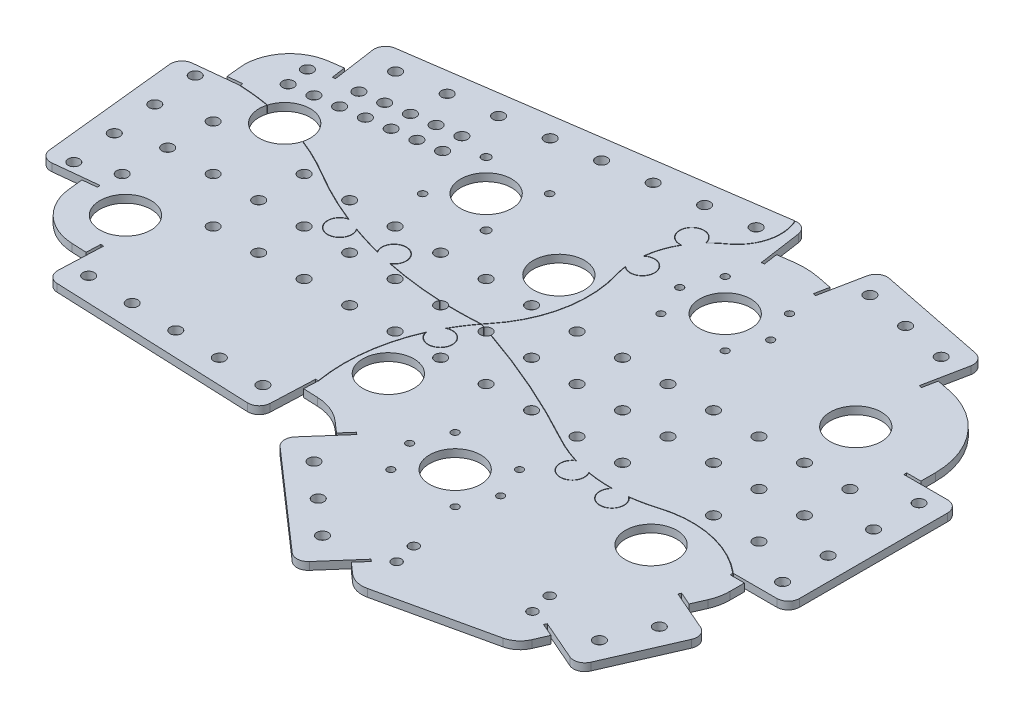
from build123d import *

# Parameters (mm, degrees)
SKETCH1_R               = 15.88080674
SKETCH1_R_2             = 2.646801123
SKETCH1_R_3             = 2.315068716
SKETCH1_R_4             = 3.529068165
SKETCH1_R_5             = 2.244487353
SKETCH1_R_6             = 2.964417258
BOSS_EXTRUDE1_DEPTH     = 4.7625
CUT_EXTRUDE_THIN3_DEPTH = 4.7625


# Read off the part's stored shape, not the designer's step: Cut-Extrude-Thin3
with BuildPart() as part:
    # Sketch1 → Boss-Extrude1 (new body)
    with BuildSketch(Plane(origin=(0, 0, 0), x_dir=(1, 0, 0), z_dir=(0, 1, 0))):
        with BuildLine():
            Line((-207.994527313, 68.690204422), (-235.016384508, 65.850092786))
            ThreePointArc((-235.016384508, 65.850092786), (-239.763810507, 63.272450781), (-241.298079484, 58.092845522))
            Line((-241.298079484, 58.092845522), (-232.55511214, -25.090932194))
            ThreePointArc((-232.55511214, -25.090932194), (-229.977470135, -29.838358193), (-224.797864877, -31.37262717))
            Line((-224.797864877, -31.37262717), (-197.776007682, -28.532515534))
            Line((-197.776007682, -28.532515534), (-197.591563646, -30.287383314))
            Line((-197.591563646, -30.287383314), (-206.365902545, -31.209603494))
            Line((-206.365902545, -31.209603494), (-205.443682365, -39.983942393))
            ThreePointArc((-205.443682365, -39.983942393), (-195.593294262, -59.82194704), (-175.172152973, -68.398284405))
            Line((-175.172152973, -68.398284405), (-166.206804345, -68.770096564))
            Line((-166.206804345, -68.770096564), (-165.84122361, -59.955003603))
            Line((-165.84122361, -59.955003603), (-164.078205018, -60.02811975))
            Line((-164.078205018, -60.02811975), (-165.204064246, -87.175485025))
            ThreePointArc((-165.204064246, -87.175485025), (-163.345363178, -92.247715527), (-158.444454465, -94.520023982))
            Line((-158.444454465, -94.520023982), (-35.19893622, -99.631278891))
            ThreePointArc((-35.19893622, -99.631278891), (-30.126705718, -97.772577824), (-27.854397263, -92.871669111))
            Line((-27.854397263, -92.871669111), (-26.728538035, -65.724303836))
            Line((-26.728538035, -65.724303836), (-24.965519442, -65.797419983))
            Line((-24.965519442, -65.797419983), (-25.331100178, -74.612512944))
            Line((-25.331100178, -74.612512944), (-16.36575155, -74.984325103))
            ThreePointArc((-16.36575155, -74.984325103), (-6.586571335, -77.078299148), (1.939798053, -82.304972855))
            Line((1.939798053, -82.304972855), (8.682308062, -88.211652405))
            Line((8.682308062, -88.211652405), (14.495969036, -81.575323656))
            Line((14.495969036, -81.575323656), (15.823234786, -82.73805585))
            Line((15.823234786, -82.73805585), (-2.080782647, -103.175598759))
            ThreePointArc((-2.080782647, -103.175598759), (-3.814497375, -108.291898708), (-1.422648427, -113.135590537))
            Line((-1.422648427, -113.135590537), (59.39156844, -166.411016249))
            ThreePointArc((59.39156844, -166.411016249), (64.507868389, -168.144730977), (69.351560218, -165.752882029))
            Line((69.351560218, -165.752882029), (87.255577651, -145.31533912))
            Line((87.255577651, -145.31533912), (88.582843401, -146.478071315))
            Line((88.582843401, -146.478071315), (82.769182427, -153.114400064))
            Line((82.769182427, -153.114400064), (89.511692436, -159.021079614))
            ThreePointArc((89.511692436, -159.021079614), (95.32752083, -162.082016245), (101.898974104, -162.17790595))
            Line((101.898974104, -162.17790595), (170.558308364, -146.799038555))
            ThreePointArc((170.558308364, -146.799038555), (176.460971128, -143.909096468), (180.415393718, -138.659740798))
            Line((180.415393718, -138.659740798), (183.994034375, -130.441247288))
            Line((183.994034375, -130.441247288), (175.90496596, -126.918963177))
            Line((175.90496596, -126.918963177), (176.609422782, -125.301149494))
            Line((176.609422782, -125.301149494), (201.52088951, -136.148537467))
            ThreePointArc((201.52088951, -136.148537467), (206.922080119, -136.245655623), (210.809971531, -132.495110024))
            Line((210.809971531, -132.495110024), (229.775779526, -88.939362223))
            ThreePointArc((229.775779526, -88.939362223), (229.872897682, -83.538171614), (226.122352083, -79.650280202))
            Line((226.122352083, -79.650280202), (201.210885355, -68.802892229))
            Line((201.210885355, -68.802892229), (201.915342177, -67.185078546))
            Line((201.915342177, -67.185078546), (210.004410593, -70.707362657))
            Line((210.004410593, -70.707362657), (213.583051249, -62.488869147))
            ThreePointArc((213.583051249, -62.488869147), (215.33746597, -56.974149481), (215.930577637, -51.217559992))
            Line((215.930577637, -51.217559992), (215.930577637, -42.253726854))
            Line((215.930577637, -42.253726854), (207.107907225, -42.253726854))
            Line((207.107907225, -42.253726854), (207.107907225, -40.489192771))
            Line((207.107907225, -40.489192771), (234.278608364, -40.489192771))
            ThreePointArc((234.278608364, -40.489192771), (239.269464425, -38.421912503), (241.336744693, -33.431056442))
            Line((241.336744693, -33.431056442), (241.336744693, 58.479727971))
            ThreePointArc((241.336744693, 58.479727971), (239.269464425, 63.470584031), (234.278608364, 65.5378643))
            Line((234.278608364, 65.5378643), (207.107907225, 65.5378643))
            Line((207.107907225, 65.5378643), (207.107907225, 67.302398382))
            Line((207.107907225, 67.302398382), (215.930577637, 67.302398382))
            Line((215.930577637, 67.302398382), (215.930577637, 76.26623152))
            ThreePointArc((215.930577637, 76.26623152), (204.734700664, 107.586523708), (176.221159535, 124.712128406))
            Line((176.221159535, 124.712128406), (167.570106519, 126.4438313))
            Line((167.570106519, 126.4438313), (165.838403626, 117.792778284))
            Line((165.838403626, 117.792778284), (164.108193023, 118.139118863))
            Line((164.108193023, 118.139118863), (169.441224813, 144.781299185))
            ThreePointArc((169.441224813, 144.781299185), (168.393756089, 150.080837013), (163.905744715, 153.087503911))
            Line((163.905744715, 153.087503911), (97.171385516, 166.4458873))
            ThreePointArc((97.171385516, 166.4458873), (91.871847687, 165.398418576), (88.865180789, 160.910407202))
            Line((88.865180789, 160.910407202), (83.532149, 134.268226881))
            Line((83.532149, 134.268226881), (81.801938397, 134.614567459))
            Line((81.801938397, 134.614567459), (83.53364129, 143.265620475))
            Line((83.53364129, 143.265620475), (74.882588275, 144.997323368))
            ThreePointArc((74.882588275, 144.997323368), (66.534394912, 145.93995154), (58.147186406, 145.454550925))
            Line((58.147186406, 145.454550925), (49.414485612, 144.197789199))
            Line((49.414485612, 144.197789199), (50.671247338, 135.465088405))
            Line((50.671247338, 135.465088405), (48.92470718, 135.21373606))
            Line((48.92470718, 135.21373606), (45.054326028, 162.107362631))
            ThreePointArc((45.054326028, 162.107362631), (42.297195161, 166.7528466), (37.062756012, 168.088113884))
            Line((37.062756012, 168.088113884), (-179.972910693, 136.853547901))
            ThreePointArc((-179.972910693, 136.853547901), (-184.618394663, 134.096417034), (-185.953661947, 128.861977885))
            Line((-185.953661947, 128.861977885), (-182.083280795, 101.968351315))
            Line((-182.083280795, 101.968351315), (-183.829820954, 101.716998969))
            Line((-183.829820954, 101.716998969), (-185.08658268, 110.449699763))
            Line((-185.08658268, 110.449699763), (-193.819283474, 109.192938037))
            ThreePointArc((-193.819283474, 109.192938037), (-212.073902944, 98.593179163), (-217.875530429, 78.297190921))
            Line((-217.875530429, 78.297190921), (-216.953310249, 69.522852022))
            Line((-216.953310249, 69.522852022), (-208.178971349, 70.445072202))
            Line((-208.178971349, 70.445072202), (-207.994527313, 68.690204422))
        make_face()
        with Locations(Location((-7.165785995, 65.679027026, 0), (0, 0, 90))):
            Circle(SKETCH1_R, mode=Mode.SUBTRACT)
        with Locations(Location((-53.796702013, 67.147119383, 0), (0, 0, 90))):
            Circle(SKETCH1_R_2, mode=Mode.SUBTRACT)
        with Locations(Location((-73.503018644, 86.853436013, 0), (0, 0, 90))):
            Circle(SKETCH1_R, mode=Mode.SUBTRACT)
        with Locations(Location((-93.209335275, 67.147119383, 0), (0, 0, 90))):
            Circle(SKETCH1_R_3, mode=Mode.SUBTRACT)
        with Locations(Location((-93.209335275, 106.559752644, 0), (0, 0, 90))):
            Circle(SKETCH1_R_2, mode=Mode.SUBTRACT)
        with Locations(Location((-53.796702013, 106.559752644, 0), (0, 0, 90))):
            Circle(SKETCH1_R_3, mode=Mode.SUBTRACT)
        with Locations(Location((28.36199031, 152.574240957, 0), (0, 0, 90))):
            Circle(SKETCH1_R_4, mode=Mode.SUBTRACT)
        with Locations(Location((0.41734777, 148.552603433, 0), (0, 0, 90))):
            Circle(SKETCH1_R_4, mode=Mode.SUBTRACT)
        with Locations(Location((-27.527294769, 144.530965909, 0), (0, 0, 90))):
            Circle(SKETCH1_R_4, mode=Mode.SUBTRACT)
        with Locations(Location((-55.471937309, 140.509328385, 0), (0, 0, 90))):
            Circle(SKETCH1_R_4, mode=Mode.SUBTRACT)
        with Locations(Location((-83.416579848, 136.487690861, 0), (0, 0, 90))):
            Circle(SKETCH1_R_4, mode=Mode.SUBTRACT)
        with Locations(Location((-111.361222388, 132.466053337, 0), (0, 0, 90))):
            Circle(SKETCH1_R_4, mode=Mode.SUBTRACT)
        with Locations(Location((-151.876467149, 90.27112741, 0), (0, 0, 90))):
            Circle(SKETCH1_R_4, mode=Mode.SUBTRACT)
        with Locations(Location((-137.904145879, 92.281946172, 0), (0, 0, 90))):
            Circle(SKETCH1_R_4, mode=Mode.SUBTRACT)
        with Locations(Location((-123.931824609, 94.292764934, 0), (0, 0, 90))):
            Circle(SKETCH1_R_4, mode=Mode.SUBTRACT)
        with Locations(Location((-109.959503339, 96.303583696, 0), (0, 0, 90))):
            Circle(SKETCH1_R_4, mode=Mode.SUBTRACT)
        with Locations(Location((-111.970322101, 110.275904966, 0), (0, 0, 90))):
            Circle(SKETCH1_R_4, mode=Mode.SUBTRACT)
        with Locations(Location((-125.942643371, 108.265086204, 0), (0, 0, 90))):
            Circle(SKETCH1_R_4, mode=Mode.SUBTRACT)
        with Locations(Location((-139.914964641, 106.254267442, 0), (0, 0, 90))):
            Circle(SKETCH1_R_4, mode=Mode.SUBTRACT)
        with Locations(Location((-139.305864927, 128.444415813, 0), (0, 0, 90))):
            Circle(SKETCH1_R_4, mode=Mode.SUBTRACT)
        with Locations(Location((-153.887285911, 104.24344868, 0), (0, 0, 90))):
            Circle(SKETCH1_R_4, mode=Mode.SUBTRACT)
        with Locations(Location((-167.250507466, 124.422778289, 0), (0, 0, 90))):
            Circle(SKETCH1_R_4, mode=Mode.SUBTRACT)
        with Locations(Location((-167.85960718, 102.232629918, 0), (0, 0, 90))):
            Circle(SKETCH1_R_4, mode=Mode.SUBTRACT)
        with Locations(Location((-165.848788418, 88.260308648, 0), (0, 0, 90))):
            Circle(SKETCH1_R_4, mode=Mode.SUBTRACT)
        with Locations(Location((-179.821109688, 86.249489886, 0), (0, 0, 90))):
            Circle(SKETCH1_R_4, mode=Mode.SUBTRACT)
        with Locations(Location((-195.80424972, 98.210992394, 0), (0, 0, 90))):
            Circle(SKETCH1_R_4, mode=Mode.SUBTRACT)
        with Locations(Location((-193.793430958, 84.238671124, 0), (0, 0, 90))):
            Circle(SKETCH1_R_4, mode=Mode.SUBTRACT)
        with Locations(Location((-197.059154913, 40.975549874, 0), (0, 0, 90))):
            Circle(SKETCH1_R_4, mode=Mode.SUBTRACT)
        with Locations(Location((-197.059154913, 12.743004558, 0), (0, 0, 90))):
            Circle(SKETCH1_R_4, mode=Mode.SUBTRACT)
        with Locations(Location((-197.059154913, -15.489540758, 0), (0, 0, 90))):
            Circle(SKETCH1_R_4, mode=Mode.SUBTRACT)
        with Locations(Location((-218.460996708, -24.140317766, 0), (0, 0, 90))):
            Circle(SKETCH1_R_4, mode=Mode.SUBTRACT)
        with Locations(Location((-221.412101285, 3.937566713, 0), (0, 0, 90))):
            Circle(SKETCH1_R_4, mode=Mode.SUBTRACT)
        with Locations(Location((-224.363205861, 32.015451192, 0), (0, 0, 90))):
            Circle(SKETCH1_R_4, mode=Mode.SUBTRACT)
        with Locations(Location((-227.314310437, 60.093335671, 0), (0, 0, 90))):
            Circle(SKETCH1_R_4, mode=Mode.SUBTRACT)
        with Locations(Location((155.451210136, 140.383561523, 0), (0, 0, 90))):
            Circle(SKETCH1_R_4, mode=Mode.SUBTRACT)
        with Locations(Location((127.767840486, 145.925010781, 0), (0, 0, 90))):
            Circle(SKETCH1_R_4, mode=Mode.SUBTRACT)
        with Locations(Location((100.084470837, 151.466460039, 0), (0, 0, 90))):
            Circle(SKETCH1_R_4, mode=Mode.SUBTRACT)
        with Locations(Location((45.22162783, 76.588002238, 0), (0, 0, 90))):
            Circle(SKETCH1_R_5, mode=Mode.SUBTRACT)
        with Locations(Location((36.952506757, 96.551426481, 0), (0, 0, 90))):
            Circle(SKETCH1_R_5, mode=Mode.SUBTRACT)
        with Locations(Location((45.22162783, 116.514850724, 0), (0, 0, 90))):
            Circle(SKETCH1_R_5, mode=Mode.SUBTRACT)
        with Locations(Location((85.148476316, 116.514850724, 0), (0, 0, 90))):
            Circle(SKETCH1_R_5, mode=Mode.SUBTRACT)
        with Locations(Location((93.417597389, 96.551426481, 0), (0, 0, 90))):
            Circle(SKETCH1_R_5, mode=Mode.SUBTRACT)
        with Locations(Location((85.148476316, 76.588002238, 0), (0, 0, 90))):
            Circle(SKETCH1_R_5, mode=Mode.SUBTRACT)
        with Locations(Location((65.185052073, 96.551426481, 0), (0, 0, 90))):
            Circle(SKETCH1_R, mode=Mode.SUBTRACT)
        with Locations(Location((166.523623333, 76.26623152, 0), (0, 0, 90))):
            Circle(SKETCH1_R, mode=Mode.SUBTRACT)
        with Locations(Location((227.220472035, 54.873153738, 0), (0, 0, 90))):
            Circle(SKETCH1_R_4, mode=Mode.SUBTRACT)
        with Locations(Location((227.220472035, 26.640608422, 0), (0, 0, 90))):
            Circle(SKETCH1_R_4, mode=Mode.SUBTRACT)
        with Locations(Location((227.220472035, -29.82448221, 0), (0, 0, 90))):
            Circle(SKETCH1_R_4, mode=Mode.SUBTRACT)
        with Locations(Location((227.220472035, -1.591936894, 0), (0, 0, 90))):
            Circle(SKETCH1_R_4, mode=Mode.SUBTRACT)
        with Locations(Location((198.196479514, -15.489540758, 0), (0, 0, 90))):
            Circle(SKETCH1_R_4, mode=Mode.SUBTRACT)
        with Locations(Location((198.196479514, 12.743004558, 0), (0, 0, 90))):
            Circle(SKETCH1_R_4, mode=Mode.SUBTRACT)
        with Locations(Location((198.196479514, 40.975549874, 0), (0, 0, 90))):
            Circle(SKETCH1_R_4, mode=Mode.SUBTRACT)
        with Locations(Location((169.963934198, 40.975549874, 0), (0, 0, 90))):
            Circle(SKETCH1_R_4, mode=Mode.SUBTRACT)
        with Locations(Location((169.963934198, 12.743004558, 0), (0, 0, 90))):
            Circle(SKETCH1_R_4, mode=Mode.SUBTRACT)
        with Locations(Location((169.963934198, -15.489540758, 0), (0, 0, 90))):
            Circle(SKETCH1_R_4, mode=Mode.SUBTRACT)
        with Locations(Location((141.731388882, 12.743004558, 0), (0, 0, 90))):
            Circle(SKETCH1_R_4, mode=Mode.SUBTRACT)
        with Locations(Location((141.731388882, 40.975549874, 0), (0, 0, 90))):
            Circle(SKETCH1_R_4, mode=Mode.SUBTRACT)
        with Locations(Location((113.498843566, 40.975549874, 0), (0, 0, 90))):
            Circle(SKETCH1_R_4, mode=Mode.SUBTRACT)
        with Locations(Location((113.498843566, 12.743004558, 0), (0, 0, 90))):
            Circle(SKETCH1_R_4, mode=Mode.SUBTRACT)
        with Locations(Location((113.498843566, -15.489540758, 0), (0, 0, 90))):
            Circle(SKETCH1_R_4, mode=Mode.SUBTRACT)
        with Locations(Location((85.266298249, -15.489540758, 0), (0, 0, 90))):
            Circle(SKETCH1_R_4, mode=Mode.SUBTRACT)
        with Locations(Location((85.266298249, 12.743004558, 0), (0, 0, 90))):
            Circle(SKETCH1_R_4, mode=Mode.SUBTRACT)
        with Locations(Location((85.266298249, 40.975549874, 0), (0, 0, 90))):
            Circle(SKETCH1_R_4, mode=Mode.SUBTRACT)
        with Locations(Location((57.033752933, 40.975549874, 0), (0, 0, 90))):
            Circle(SKETCH1_R_4, mode=Mode.SUBTRACT)
        with Locations(Location((57.033752933, 12.743004558, 0), (0, 0, 90))):
            Circle(SKETCH1_R_4, mode=Mode.SUBTRACT)
        with Locations(Location((57.033752933, -15.489540758, 0), (0, 0, 90))):
            Circle(SKETCH1_R_4, mode=Mode.SUBTRACT)
        with Locations(Location((28.801207617, -15.489540758, 0), (0, 0, 90))):
            Circle(SKETCH1_R_4, mode=Mode.SUBTRACT)
        with Locations(Location((28.801207617, 12.743004558, 0), (0, 0, 90))):
            Circle(SKETCH1_R_4, mode=Mode.SUBTRACT)
        with Locations(Location((28.801207617, 40.975549874, 0), (0, 0, 90))):
            Circle(SKETCH1_R_4, mode=Mode.SUBTRACT)
        with Locations(Location((0.568662301, 40.975549874, 0), (0, 0, 90))):
            Circle(SKETCH1_R_4, mode=Mode.SUBTRACT)
        with Locations(Location((0.568662301, 12.743004558, 0), (0, 0, 90))):
            Circle(SKETCH1_R_4, mode=Mode.SUBTRACT)
        with Locations(Location((-27.663883015, 40.975549874, 0), (0, 0, 90))):
            Circle(SKETCH1_R_4, mode=Mode.SUBTRACT)
        with Locations(Location((-27.663883015, 12.743004558, 0), (0, 0, 90))):
            Circle(SKETCH1_R_4, mode=Mode.SUBTRACT)
        with Locations(Location((-55.896428332, 12.743004558, 0), (0, 0, 90))):
            Circle(SKETCH1_R_4, mode=Mode.SUBTRACT)
        with Locations(Location((-55.896428332, 40.975549874, 0), (0, 0, 90))):
            Circle(SKETCH1_R_4, mode=Mode.SUBTRACT)
        with Locations(Location((-84.128973648, 40.975549874, 0), (0, 0, 90))):
            Circle(SKETCH1_R_4, mode=Mode.SUBTRACT)
        with Locations(Location((-112.361518964, 40.975549874, 0), (0, 0, 90))):
            Circle(SKETCH1_R_4, mode=Mode.SUBTRACT)
        with Locations(Location((-84.128973648, 12.743004558, 0), (0, 0, 90))):
            Circle(SKETCH1_R_4, mode=Mode.SUBTRACT)
        with Locations(Location((-112.361518964, 12.743004558, 0), (0, 0, 90))):
            Circle(SKETCH1_R_4, mode=Mode.SUBTRACT)
        with Locations(Location((-140.59406428, 12.743004558, 0), (0, 0, 90))):
            Circle(SKETCH1_R_4, mode=Mode.SUBTRACT)
        with Locations(Location((-140.59406428, -15.489540758, 0), (0, 0, 90))):
            Circle(SKETCH1_R_4, mode=Mode.SUBTRACT)
        with Locations(Location((-112.361518964, -15.489540758, 0), (0, 0, 90))):
            Circle(SKETCH1_R_4, mode=Mode.SUBTRACT)
        with Locations(Location((-84.128973648, -15.489540758, 0), (0, 0, 90))):
            Circle(SKETCH1_R_4, mode=Mode.SUBTRACT)
        with Locations(Location((-55.896428332, -15.489540758, 0), (0, 0, 90))):
            Circle(SKETCH1_R_4, mode=Mode.SUBTRACT)
        with Locations(Location((-27.663883015, -15.489540758, 0), (0, 0, 90))):
            Circle(SKETCH1_R_4, mode=Mode.SUBTRACT)
        with Locations(Location((0.568662301, -15.489540758, 0), (0, 0, 90))):
            Circle(SKETCH1_R_4, mode=Mode.SUBTRACT)
        with Locations(Location((-7.165785995, -40.19301791, 0), (0, 0, 90))):
            Circle(SKETCH1_R, mode=Mode.SUBTRACT)
        with Locations(Location((45.22162783, -51.101993121, 0), (0, 0, 90))):
            Circle(SKETCH1_R_5, mode=Mode.SUBTRACT)
        with Locations(Location((36.952506757, -71.065417365, 0), (0, 0, 90))):
            Circle(SKETCH1_R_5, mode=Mode.SUBTRACT)
        with Locations(Location((45.22162783, -91.028841608, 0), (0, 0, 90))):
            Circle(SKETCH1_R_5, mode=Mode.SUBTRACT)
        with Locations(Location((85.148476316, -91.028841608, 0), (0, 0, 90))):
            Circle(SKETCH1_R_5, mode=Mode.SUBTRACT)
        with Locations(Location((93.417597389, -71.065417365, 0), (0, 0, 90))):
            Circle(SKETCH1_R_5, mode=Mode.SUBTRACT)
        with Locations(Location((85.148476316, -51.101993121, 0), (0, 0, 90))):
            Circle(SKETCH1_R_5, mode=Mode.SUBTRACT)
        with Locations(Location((166.523623333, -50.780222403, 0), (0, 0, 90))):
            Circle(SKETCH1_R, mode=Mode.SUBTRACT)
        with Locations(Location((212.986020642, -92.139072081, 0), (0, 0, 90))):
            Circle(SKETCH1_R_4, mode=Mode.SUBTRACT)
        with Locations(Location((201.714711487, -118.02409101, 0), (0, 0, 90))):
            Circle(SKETCH1_R_4, mode=Mode.SUBTRACT)
        with Locations(Location((165.420801083, -123.357493008, 0), (0, 0, 90))):
            Circle(SKETCH1_R_6, mode=Mode.SUBTRACT)
        with Locations(Location((162.335376973, -109.582540674, 0), (0, 0, 90))):
            Circle(SKETCH1_R_6, mode=Mode.SUBTRACT)
        with Locations(Location((93.4606153, -125.009661225, 0), (0, 0, 90))):
            Circle(SKETCH1_R_6, mode=Mode.SUBTRACT)
        with Locations(Location((96.546039411, -138.784613559, 0), (0, 0, 90))):
            Circle(SKETCH1_R_6, mode=Mode.SUBTRACT)
        with Locations(Location((59.522569562, -147.758892512, 0), (0, 0, 90))):
            Circle(SKETCH1_R_4, mode=Mode.SUBTRACT)
        with Locations(Location((38.286317565, -129.155177395, 0), (0, 0, 90))):
            Circle(SKETCH1_R_4, mode=Mode.SUBTRACT)
        with Locations(Location((17.050065568, -110.551462278, 0), (0, 0, 90))):
            Circle(SKETCH1_R_4, mode=Mode.SUBTRACT)
        with Locations(Location((-39.921852993, -85.307002444, 0), (0, 0, 90))):
            Circle(SKETCH1_R_4, mode=Mode.SUBTRACT)
        with Locations(Location((-68.130150469, -84.137144091, 0), (0, 0, 90))):
            Circle(SKETCH1_R_4, mode=Mode.SUBTRACT)
        with Locations(Location((-96.338447944, -82.967285738, 0), (0, 0, 90))):
            Circle(SKETCH1_R_4, mode=Mode.SUBTRACT)
        with Locations(Location((-124.54674542, -81.797427385, 0), (0, 0, 90))):
            Circle(SKETCH1_R_4, mode=Mode.SUBTRACT)
        with Locations(Location((-152.755042895, -80.627569033, 0), (0, 0, 90))):
            Circle(SKETCH1_R_4, mode=Mode.SUBTRACT)
        with Locations(Location((-173.856062327, -36.663949745, 0), (0, 0, 90))):
            Circle(SKETCH1_R, mode=Mode.SUBTRACT)
        with Locations(Location((-168.826609597, 12.743004558, 0), (0, 0, 90))):
            Circle(SKETCH1_R_4, mode=Mode.SUBTRACT)
        with Locations(Location((-140.59406428, 40.975549874, 0), (0, 0, 90))):
            Circle(SKETCH1_R_4, mode=Mode.SUBTRACT)
        with Locations(Location((65.185052073, -71.065417365, 0), (0, 0, 90))):
            Circle(SKETCH1_R, mode=Mode.SUBTRACT)
        with Locations(Location((-173.856062327, 62.149958862, 0), (0, 0, 90))):
            Circle(SKETCH1_R, mode=Mode.SUBTRACT)
    extrude(amount=BOSS_EXTRUDE1_DEPTH)

    # Cut-Extrude-Thin3 outline → Cut-Extrude-Thin3 (cut)
    with BuildSketch(Plane(origin=(0, 0, 0), x_dir=(1, 0, 0), z_dir=(0, 1, 0))):
        with BuildLine():
            ThreePointArc((4.05020196, 12.165766559), (43.449358347, -3.244296378), (81.392453769, -21.954856859))
            ThreePointArc((81.392453769, -21.954856859), (89.302103367, -25.778704162), (97.556786599, -28.786123272))
            ThreePointArc((97.556786599, -28.786123272), (100.132804747, -42.476101593), (108.600535843, -31.414957619))
            ThreePointArc((108.600535843, -31.414957619), (116.109802617, -32.358476473), (123.672633185, -32.646415883))
            ThreePointArc((123.672633185, -32.646415883), (129.770480963, -45.437893738), (134.140257643, -31.957882425))
            ThreePointArc((134.140257643, -31.957882425), (141.61002378, -30.679660908), (148.940371534, -28.756835335))
            ThreePointArc((148.940371534, -28.756835335), (179.496439901, -27.240760844), (207.025910083, -40.586174567))
            Line((207.025910083, -40.586174567), (207.107907225, -40.489192771))
            Line((207.107907225, -40.489192771), (207.314348075, -40.489192771))
            Line((207.314348075, -40.489192771), (207.188000082, -40.390600988))
            ThreePointArc((207.188000082, -40.390600988), (179.545905752, -26.991620968), (148.865295493, -28.514184169))
            ThreePointArc((148.865295493, -28.514184169), (141.251986239, -30.49665529), (133.490487209, -31.781879921))
            ThreePointArc((133.490487209, -31.781879921), (129.753809522, -45.184441449), (124.29375092, -32.386817618))
            ThreePointArc((124.29375092, -32.386817618), (116.166945261, -32.108291159), (108.101834114, -31.070731811))
            ThreePointArc((108.101834114, -31.070731811), (100.191623026, -42.22900564), (98.157093863, -28.703503602))
            ThreePointArc((98.157093863, -28.703503602), (89.654162249, -25.651266182), (81.514401201, -21.732045675))
            ThreePointArc((81.514401201, -21.732045675), (43.528008662, -3.001375524), (4.083188574, 12.422962084))
            ThreePointArc((4.083188574, 12.422962084), (4.069058282, 12.294061253), (4.05020196, 12.165766559))
        make_face()
        Polygon((-24.854206624, -65.858562902), (-24.965519442, -65.797419983), (-24.977352894, -66.082754985), align=None)
        Polygon((-208.042328138, 68.572543548), (-207.994527313, 68.690204422), (-208.262595706, 68.662029299), align=None)
        Polygon((207.107907225, -40.650282562), (207.107907225, -40.489192771), (207.029778308, -40.589317056), align=None)
        with BuildLine():
            ThreePointArc((-4.866512611, 15.127763301), (-3.711951749, 14.754778673), (-2.558306483, 14.378971652))
            ThreePointArc((-2.558306483, 14.378971652), (-2.4960933, 14.49274603), (-2.429742264, 14.604158011))
            ThreePointArc((-2.429742264, 14.604158011), (-3.565623892, 14.974334873), (-4.702393148, 15.341776897))
            ThreePointArc((-4.702393148, 15.341776897), (-3.680650981, 16.648935589), (-2.638249769, 17.939679798))
            ThreePointArc((-2.638249769, 17.939679798), (12.187937777, 49.175281828), (10.628695026, 83.715800547))
            ThreePointArc((10.628695026, 83.715800547), (9.764065221, 87.080532861), (9.155526858, 90.500867538))
            ThreePointArc((9.155526858, 90.500867538), (21.425796902, 96.607419674), (9.06719011, 102.533155418))
            ThreePointArc((9.06719011, 102.533155418), (11.121856768, 111.544401739), (14.934449143, 119.963923977))
            ThreePointArc((14.934449143, 119.963923977), (7.87767642, 131.642035408), (21.100297352, 128.27474814))
            ThreePointArc((21.100297352, 128.27474814), (24.518247297, 131.577669045), (28.258417882, 134.510720752))
            ThreePointArc((28.258417882, 134.510720752), (38.83349144, 149.683836694), (37.194702437, 168.105834381))
            ThreePointArc((37.194702437, 168.105834381), (37.128687443, 168.097285237), (37.062756012, 168.088113884))
            Line((37.062756012, 168.088113884), (36.931336762, 168.069200757))
            Line((36.931336762, 168.069200757), (36.947793545, 168.034145086))
            ThreePointArc((36.947793545, 168.034145086), (38.593116731, 149.768292826), (28.112200765, 134.718414167))
            ThreePointArc((28.112200765, 134.718414167), (24.543255468, 131.935400922), (21.263013835, 128.817300846))
            ThreePointArc((21.263013835, 128.817300846), (7.673686618, 131.793376614), (14.462389581, 119.650874678))
            ThreePointArc((14.462389581, 119.650874678), (10.699139354, 111.073331428), (8.738937246, 101.91396965))
            ThreePointArc((8.738937246, 101.91396965), (21.171803747, 96.605554948), (8.818218188, 91.115166992))
            ThreePointArc((8.818218188, 91.115166992), (9.447496264, 87.346911667), (10.385246806, 83.643350812))
            ThreePointArc((10.385246806, 83.643350812), (11.938951945, 49.225501897), (-2.83458076, 18.10083234))
            ThreePointArc((-2.83458076, 18.10083234), (-3.917813187, 16.75872101), (-4.978763959, 15.398927359))
            ThreePointArc((-4.978763959, 15.398927359), (-14.936397654, 14.949133192), (-24.904182834, 14.942635668))
            ThreePointArc((-24.904182834, 14.942635668), (-24.807646784, 14.815741083), (-24.71694081, 14.684615682))
            ThreePointArc((-24.71694081, 14.684615682), (-14.94555384, 14.694857424), (-5.183882813, 15.130617685))
            ThreePointArc((-5.183882813, 15.130617685), (-9.753851049, 8.635114961), (-13.817685915, 1.811522688))
            ThreePointArc((-13.817685915, 1.811522688), (-3.773116862, -7.972636583), (-17.652124494, -5.973564986))
            ThreePointArc((-17.652124494, -5.973564986), (-25.776201197, -35.326338072), (-25.098148726, -65.775084433))
            Line((-25.098148726, -65.775084433), (-25.107190115, -65.791544597))
            Line((-25.107190115, -65.791544597), (-24.965519442, -65.797419983))
            Line((-24.965519442, -65.797419983), (-24.840325089, -65.776080493))
            ThreePointArc((-24.840325089, -65.776080493), (-25.573706552, -35.762188292), (-17.728783662, -6.782389151))
            ThreePointArc((-17.728783662, -6.782389151), (-3.545256161, -8.08486626), (-13.223212189, 2.365304366))
            ThreePointArc((-13.223212189, 2.365304366), (-9.278459991, 8.899490635), (-4.866512611, 15.127763301))
        make_face()
        with BuildLine():
            ThreePointArc((-66.05552667, 19.401125098), (-48.355267331, 16.427254286), (-30.473914374, 14.877962607))
            ThreePointArc((-30.473914374, 14.877962607), (-30.374615069, 15.002706716), (-30.269782687, 15.122838378))
            ThreePointArc((-30.269782687, 15.122838378), (-47.909907345, 16.627074235), (-65.376213242, 19.519284765))
            ThreePointArc((-65.376213242, 19.519284765), (-67.903685701, 33.277653253), (-76.243067305, 22.046645509))
            ThreePointArc((-76.243067305, 22.046645509), (-85.651692077, 24.703596402), (-94.935462731, 27.768430913))
            ThreePointArc((-94.935462731, 27.768430913), (-103.335971993, 16.333097108), (-102.170135186, 30.474392651))
            ThreePointArc((-102.170135186, 30.474392651), (-118.983033797, 37.905736433), (-135.130234189, 46.690174356))
            ThreePointArc((-135.130234189, 46.690174356), (-146.570050039, 52.908295393), (-158.484876395, 58.159136167))
            ThreePointArc((-158.484876395, 58.159136167), (-158.517489227, 58.035569724), (-158.551095372, 57.912269724))
            ThreePointArc((-158.551095372, 57.912269724), (-146.66923387, 52.674027243), (-135.260666034, 46.472221301))
            ThreePointArc((-135.260666034, 46.472221301), (-119.448912744, 37.852251271), (-102.996664918, 30.528388433))
            ThreePointArc((-102.996664918, 30.528388433), (-103.424954341, 16.095193469), (-94.276373525, 27.266765326))
            ThreePointArc((-94.276373525, 27.266765326), (-85.041912514, 24.252500169), (-75.685614112, 21.640844599))
            ThreePointArc((-75.685614112, 21.640844599), (-67.961224133, 33.030256145), (-66.05552667, 19.401125098))
        make_face()
        with BuildLine():
            ThreePointArc((-208.000928206, 68.563365829), (-198.5386197, 67.798605753), (-189.139794354, 66.463606744))
            ThreePointArc((-189.139794354, 66.463606744), (-189.104586501, 66.586458972), (-189.068391167, 66.709023896))
            ThreePointArc((-189.068391167, 66.709023896), (-198.485656456, 68.048276659), (-207.966645307, 68.815957501))
            Line((-207.966645307, 68.815957501), (-208.009577689, 68.83339918))
            Line((-208.009577689, 68.83339918), (-207.994527313, 68.690204422))
            Line((-207.994527313, 68.690204422), (-208.000928206, 68.563365829))
        make_face()
    extrude(amount=CUT_EXTRUDE_THIN3_DEPTH, mode=Mode.SUBTRACT)


solid = part.part
